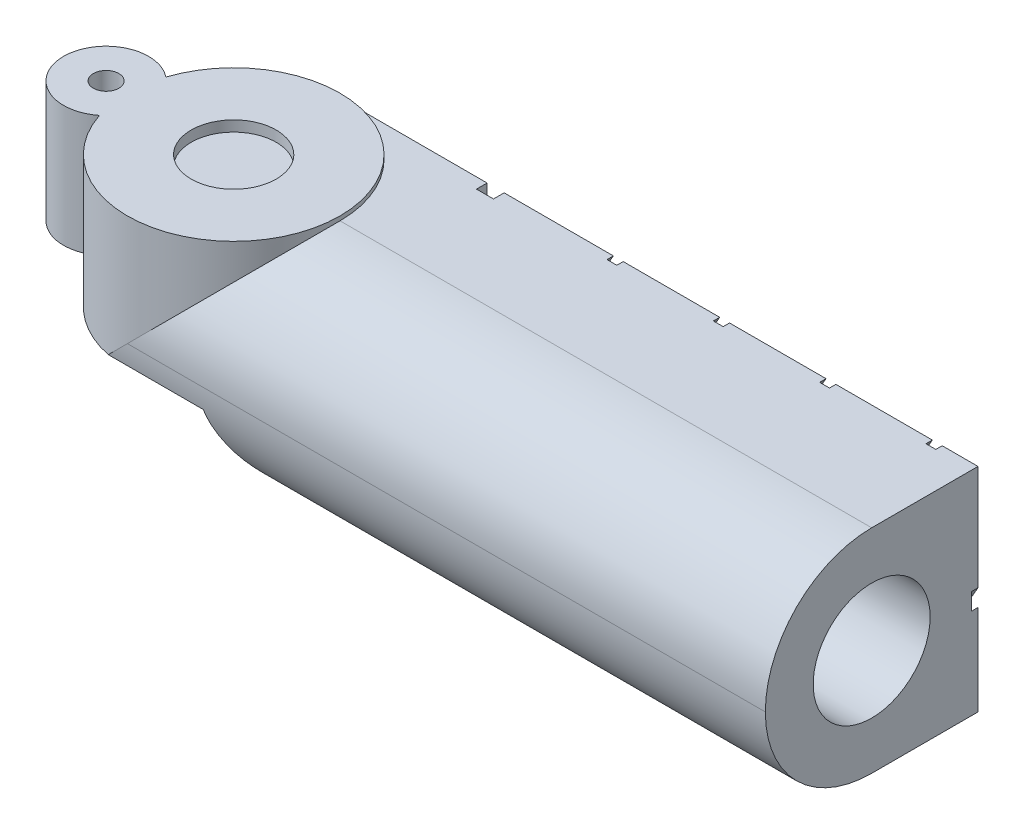
from build123d import *

# Parameters (mm, degrees)
SKETCH_1_W          = 35
SKETCH_1_H          = 10
EXTRUDE_1_DEPTH     = 10
FILLET_1_R          = 5
SKETCH_3_R          = 6
CUT_EXTRUDE_1_DEPTH = 4
SKETCH_7_R          = 5
EXTRUDE_4_DEPTH     = 0.2
SKETCH_8_R          = 2
CUT_EXTRUDE_3_DEPTH = 0.5
FILLET_3_R          = 5
SKETCH_10_R         = 2
EXTRUDE_5_DEPTH     = 5.7
SKETCH_11_R         = 0.6
CUT_EXTRUDE_4_DEPTH = 24.436936812
SKETCH_12_R         = 2.75
CUT_EXTRUDE_5_DEPTH = 23
SKETCH_6_R          = 1.25
CUT_EXTRUDE_6_DEPTH = 4
FILLET_4_R          = 1
SKETCH_13_W         = 0.8
SKETCH_13_H         = 10
CUT_EXTRUDE_7_DEPTH = 0.5
CUT_EXTRUDE_8_DEPTH = 0.3


# Some blends are built 0.0001 mm under size
with BuildPart() as part:
    # 草图1 → 凸台-拉伸1 (new body)
    with BuildSketch(Plane(origin=(0, 0, 0), x_dir=(1, 0, 0), z_dir=(0, 1, 0))):
        Rectangle(SKETCH_1_W, SKETCH_1_H)
    extrude(amount=EXTRUDE_1_DEPTH)

    # 圆角1
    fillet_1_edges = [part.edges().sort_by_distance(p)[0] for p in [
        (-17.5, 5, 5),
        (-17.5, 5, -5),
    ]]
    fillet(fillet_1_edges, radius=FILLET_1_R - 0.0001)  # a hair under: the kernel refuses the full size

    # 草图3 → 切除-拉伸1 (cut)
    with BuildSketch(Plane.XZ):
        with Locations((-12.5, 0)):
            Circle(SKETCH_3_R)
    extrude(amount=-CUT_EXTRUDE_1_DEPTH, mode=Mode.SUBTRACT)

    # 草图7 → 凸台-拉伸4 (add)
    with BuildSketch(Plane(origin=(0, 10, 0), x_dir=(1, 0, 0), z_dir=(0, 1, 0))):
        with Locations(Location((-12.5, 0, 0), (0, 0, 270))):
            Circle(SKETCH_7_R)
    extrude(amount=EXTRUDE_4_DEPTH)

    # 草图8 → 切除-拉伸3 (cut)
    with BuildSketch(Plane(origin=(0, 10.2, 0), x_dir=(1, 0, 0), z_dir=(0, 1, 0))):
        with Locations(Location((-12.5, 0, 0), (0, 0, 270))):
            Circle(SKETCH_8_R)
    extrude(amount=-CUT_EXTRUDE_3_DEPTH, mode=Mode.SUBTRACT)

    # 圆角3
    # the kernel refuses this fillet: 5 mm, written as the material it takes off along each edge
    with BuildSketch(Plane(origin=(30, 0, 5), x_dir=(0, 1, 0), z_dir=(-1, 0, 0))) as fillet_3_piece_1:
        with BuildLine():
            CenterArc((FILLET_3_R, FILLET_3_R), FILLET_3_R, 180, 90)
            Line((0, FILLET_3_R), (0, 0))
            Line((0, 0), (FILLET_3_R, 0))
        make_face()
    extrude(amount=51.68337521, mode=Mode.SUBTRACT)
    with BuildSketch(Plane(origin=(30, 10, 5), x_dir=(0, -1, 0), z_dir=(-1, 0, 0))) as fillet_3_piece_2_section:
        with BuildLine():
            CenterArc((FILLET_3_R, -FILLET_3_R), FILLET_3_R, 90, 90)
            Line((0, -FILLET_3_R), (0, 0))
            Line((0, 0), (FILLET_3_R, 0))
        make_face()
    fillet_3_piece_2 = extrude(amount=55, mode=Mode.PRIVATE)
    fillet_3_piece_2 = fillet_3_piece_2 - Plane(origin=(-12.5, 8.593554342, 0), x_dir=(0, 0, 1), z_dir=(0, -1, 0)) * Cylinder(5, 130, mode=Mode.PRIVATE)
    add(fillet_3_piece_2, mode=Mode.SUBTRACT)

    # 草图10 → 凸台-拉伸5 (add)
    with BuildSketch(Plane(origin=(0, 10.2, 0), x_dir=(1, 0, 0), z_dir=(0, 1, 0))):
        with Locations((-18.5, 0)):
            Circle(SKETCH_10_R)
    extrude(amount=-EXTRUDE_5_DEPTH)

    # 草图11 → 切除-拉伸4 (cut, through all)
    with BuildSketch(Plane(origin=(0, 10.2, 0), x_dir=(1, 0, 0), z_dir=(0, 1, 0))):
        with Locations(Location((-18.5, 0, 0), (0, 0, 270))):
            Circle(SKETCH_11_R)
    extrude(amount=-CUT_EXTRUDE_4_DEPTH, mode=Mode.SUBTRACT)

    # 草图12 → 切除-拉伸5 (cut)
    with BuildSketch(Plane(origin=(17.5, 0, 0), x_dir=(0, 0, -1), z_dir=(1, 0, 0))):
        with Locations((0, 5)):
            Circle(SKETCH_12_R)
    extrude(amount=-CUT_EXTRUDE_5_DEPTH, mode=Mode.SUBTRACT)

    # 草图6 → 切除-拉伸6 (cut)
    with BuildSketch(Plane.XZ.offset(-4)):
        with Locations(Location((-12.5, 0, 0), (0, 0, 270))):
            Circle(SKETCH_6_R)
    extrude(amount=-CUT_EXTRUDE_6_DEPTH, mode=Mode.SUBTRACT)

    # 圆角4
    fillet_4_edges = [part.edges().sort_by_distance(p)[0] for p in [
        (-5.5, 5, 2.75),
    ]]
    fillet(fillet_4_edges, radius=FILLET_4_R)

    # 草图13 → 切除-拉伸7 (cut)
    with BuildSketch(Plane(origin=(0, 0, -5), x_dir=(-1, 0, 0), z_dir=(0, 0, -1))):
        with Locations((5.18337521, 5)):
            Rectangle(SKETCH_13_W, SKETCH_13_H)
    extrude(amount=-CUT_EXTRUDE_7_DEPTH, mode=Mode.SUBTRACT)

    # 草图14 → 切除-拉伸8 (cut)
    with BuildSketch(Plane(origin=(0, 0, -5), x_dir=(-1, 0, 0), z_dir=(0, 0, -1))):
        Polygon((-10.031126924, -7.880483284), (-20.59026218, 10.408475463), (-20.936672342, 10.208475463), (-10.377537086, -8.080483284), align=None)
        Polygon((-5.031126924, -7.880483284), (-15.59026218, 10.408475463), (-15.936672342, 10.208475463), (-5.377537086, -8.080483284), align=None)
        Polygon((-0.031126924, -7.880483284), (-10.59026218, 10.408475463), (-10.936672342, 10.208475463), (-0.377537086, -8.080483284), align=None)
        Polygon((4.968873076, -7.880483284), (-5.59026218, 10.408475463), (-5.936672342, 10.208475463), (4.622462914, -8.080483284), align=None)
        Polygon((9.968873076, -7.880483284), (-0.59026218, 10.408475463), (-0.936672342, 10.208475463), (9.622462914, -8.080483284), align=None)
    extrude(amount=-CUT_EXTRUDE_8_DEPTH, mode=Mode.SUBTRACT)


solid = part.part
